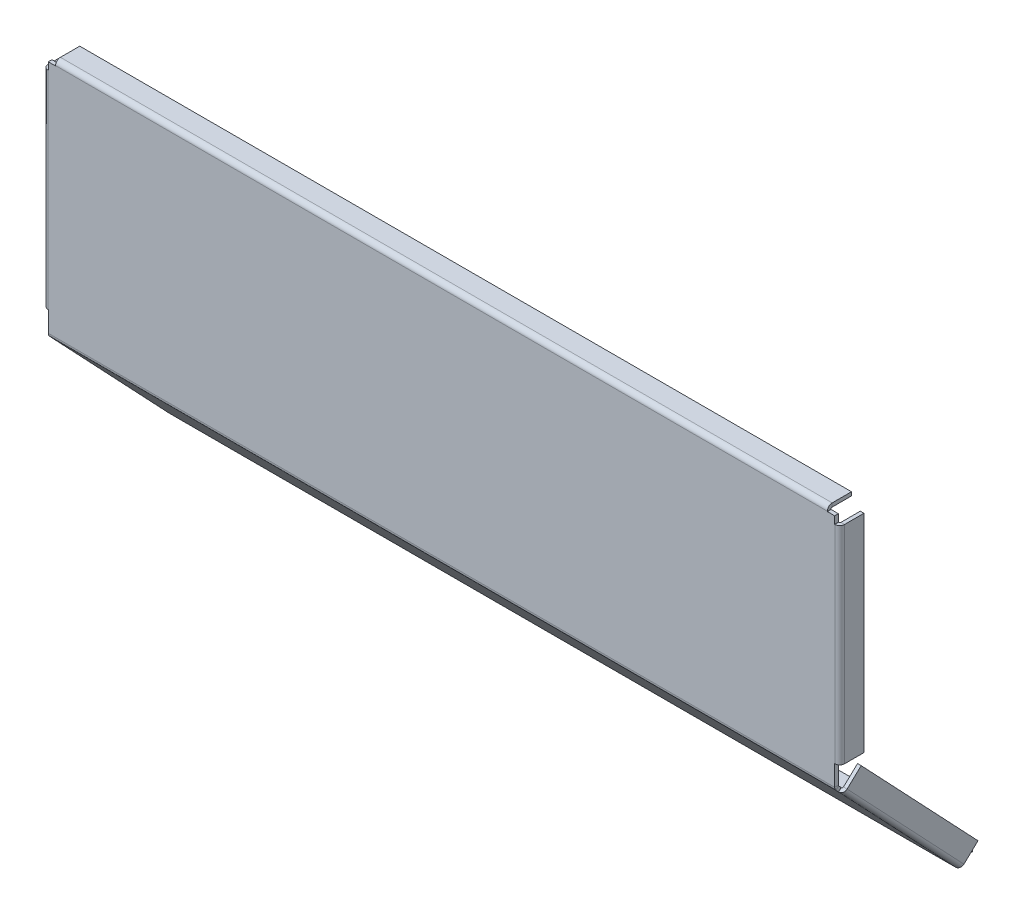
from build123d import *

# Parameters (mm, degrees)
SKETCH1_W                 = 682.625
SKETCH1_H                 = 203.2
BASE_FLANGE1_DEPTH        = 3.175
EDGE_FLANGE1_DEPTH        = 682.625
EDGE_FLANGE3_DEPTH        = 669.925
EDGE_FLANGE3_BEND_DEPTH   = 179.941884035
EDGE_FLANGE3_BEND_2_DEPTH = 179.941884035
EDGE_FLANGE3_BEND_3_DEPTH = 147.556884035
EDGE_FLANGE3_BEND_4_DEPTH = 147.556884035
EDGE_FLANGE4_DEPTH        = 670.465


# Sheet-metal steps are written as plain solids
with BuildPart() as part:
    # Sketch1 → Base-Flange1 (new body)
    with BuildSketch(Plane.XY):
        Rectangle(SKETCH1_W, SKETCH1_H)
    extrude(amount=-BASE_FLANGE1_DEPTH)

    # Edge-Flange1 section (across the edge) → Edge-Flange1 (add)
    with BuildSketch(Plane(origin=(341.3125, -102.87, -3.175), x_dir=(0, 0.6872977622647618, -0.7263757884083493), z_dir=(-1, 0, 0))):
        with BuildLine():
            Line((-3.175, 0.398115965), (-3.175, 151.13))
            Line((-3.175, 151.13), (0, 151.13))
            Line((0, 151.13), (0, 0.398115965))
            ThreePointArc((0, 0.398115965), (0.070920943, 0.02823476), (0.273624212, -0.289181798))
            Line((0.273624212, -0.289181798), (0.872868158, -0.922497251))
            Line((0.872868158, -0.922497251), (-1.43337497, -3.104667646))
            Line((-1.43337497, -3.104667646), (-2.032618917, -2.471352193))
            ThreePointArc((-2.032618917, -2.471352193), (-2.878905063, -1.146138066), (-3.175, 0.398115965))
        make_face()
    extrude(amount=EDGE_FLANGE1_DEPTH)

    # Edge-Flange3 section (across the edge) → Edge-Flange3 (add)
    with BuildSketch(Plane(origin=(-334.9625, 102.87, -3.175), x_dir=(0, -1, 0), z_dir=(1, 0, 0))):
        with BuildLine():
            Line((-3.175, 1), (-3.175, 17.78))
            Line((-3.175, 17.78), (0, 17.78))
            Line((0, 17.78), (0, 1))
            ThreePointArc((0, 1), (0.292893219, 0.292893219), (1, 0))
            Line((1, 0), (1.27, 0))
            Line((1.27, 0), (1.27, -3.175))
            Line((1.27, -3.175), (1, -3.175))
            ThreePointArc((1, -3.175), (-1.952170811, -1.952170811), (-3.175, 1))
        make_face()
    extrude(amount=EDGE_FLANGE3_DEPTH)

    # Edge-Flange3 section 2 (across the edge) → Edge-Flange3 bend (add)
    with BuildSketch(Plane(origin=(-342.5825, -84.691884035, -3.175), x_dir=(1, 0, 0), z_dir=(0, 1, 0))):
        with BuildLine():
            Line((-3.175, 1), (-3.175, 17.78))
            Line((-3.175, 17.78), (0, 17.78))
            Line((0, 17.78), (0, 1))
            ThreePointArc((0, 1), (0.292893219, 0.292893219), (1, 0))
            Line((1, 0), (1.27, 0))
            Line((1.27, 0), (1.27, -3.175))
            Line((1.27, -3.175), (1, -3.175))
            ThreePointArc((1, -3.175), (-1.952170811, -1.952170811), (-3.175, 1))
        make_face()
    extrude(amount=EDGE_FLANGE3_BEND_DEPTH)

    # Edge-Flange3 section 3 (across the edge) → Edge-Flange3 bend 2 (add)
    with BuildSketch(Plane(origin=(342.5825, 95.25, -3.175), x_dir=(-1, 0, 0), z_dir=(0, -1, 0))):
        with BuildLine():
            Line((-3.175, 1), (-3.175, 17.78))
            Line((-3.175, 17.78), (0, 17.78))
            Line((0, 17.78), (0, 1))
            ThreePointArc((0, 1), (0.292893219, 0.292893219), (1, 0))
            Line((1, 0), (1.27, 0))
            Line((1.27, 0), (1.27, -3.175))
            Line((1.27, -3.175), (1, -3.175))
            ThreePointArc((1, -3.175), (-1.952170811, -1.952170811), (-3.175, 1))
        make_face()
    extrude(amount=EDGE_FLANGE3_BEND_2_DEPTH)

    # Edge-Flange3 section 4 (across the edge) → Edge-Flange3 bend 3 (add)
    with BuildSketch(Plane(origin=(-342.5825, -212.647172902, -107.046310811), x_dir=(1, 0, 0), z_dir=(1.4731097295439079e-15, 0.7263757884083494, 0.6872977622647618))):
        with BuildLine():
            Line((-3.175, 1), (-3.175, 17.78))
            Line((-3.175, 17.78), (0, 17.78))
            Line((0, 17.78), (0, 1))
            ThreePointArc((0, 1), (0.292893219, 0.292893219), (1, 0))
            Line((1, 0), (1.27, 0))
            Line((1.27, 0), (1.27, -3.175))
            Line((1.27, -3.175), (1, -3.175))
            ThreePointArc((1, -3.175), (-1.952170811, -1.952170811), (-3.175, 1))
        make_face()
    extrude(amount=EDGE_FLANGE3_BEND_3_DEPTH)

    # Edge-Flange3 section 5 (across the edge) → Edge-Flange3 bend 4 (add)
    with BuildSketch(Plane(origin=(342.5825, -105.465424926, -5.630794607), x_dir=(-1, 0, 0), z_dir=(-1.4731097295439075e-15, -0.7263757884083494, -0.6872977622647617))):
        with BuildLine():
            Line((-3.175, 1), (-3.175, 17.78))
            Line((-3.175, 17.78), (0, 17.78))
            Line((0, 17.78), (0, 1))
            ThreePointArc((0, 1), (0.292893219, 0.292893219), (1, 0))
            Line((1, 0), (1.27, 0))
            Line((1.27, 0), (1.27, -3.175))
            Line((1.27, -3.175), (1, -3.175))
            ThreePointArc((1, -3.175), (-1.952170811, -1.952170811), (-3.175, 1))
        make_face()
    extrude(amount=EDGE_FLANGE3_BEND_4_DEPTH)

    # Edge-Flange4 section (across the edge) → Edge-Flange4 (add)
    with BuildSketch(Plane(origin=(335.2325, -213.569670153, -107.919178969), x_dir=(0, 0.9999999999999994, 3.7524568563540583e-08), z_dir=(-1, 0, 0))):
        with BuildLine():
            Line((-3.175, 0.430496527), (-3.175, 17.78))
            Line((-3.175, 17.78), (0, 17.78))
            Line((0, 17.78), (0, 0.430496527))
            ThreePointArc((0, 0.430496527), (0.081496398, 0.035083916), (0.312702265, -0.295879288))
            Line((0.312702265, -0.295879288), (0.922497284, -0.872868123))
            Line((0.922497284, -0.872868123), (-1.259673025, -3.179111334))
            Line((-1.259673025, -3.179111334), (-1.869468044, -2.602122498))
            ThreePointArc((-1.869468044, -2.602122498), (-2.83475254, -1.220351122), (-3.175, 0.430496527))
        make_face()
    extrude(amount=EDGE_FLANGE4_DEPTH)


solid = part.part
